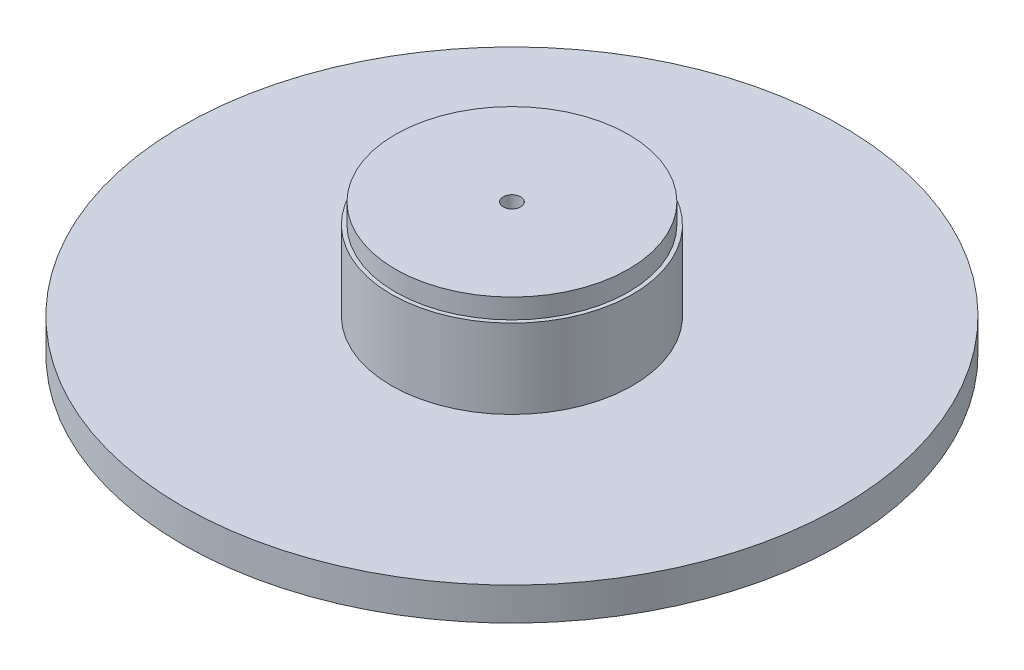
from build123d import *

# Parameters (mm, degrees)
SKETCH1_R                                           = 127
SKETCH1_R_2                                         = 46.482
BOSS_EXTRUDE4_DEPTH                                 = 12.7
SKETCH1_6_R                                         = 46.482
SKETCH1_6_R_2                                       = 44.958
BOSS_EXTRUDE5_DEPTH                                 = 43.18
SKETCH1_7_R                                         = 44.958
BOSS_EXTRUDE6_DEPTH                                 = 50.8
CSK_FOR_1_4_FLAT_HEAD_MACHINE_SCREW_100_D           = 6.7564
CSK_FOR_1_4_FLAT_HEAD_MACHINE_SCREW_100_CSINK_D     = 12.8778
CSK_FOR_1_4_FLAT_HEAD_MACHINE_SCREW_100_CSINK_ANGLE = 100


with BuildPart() as part:
    # Sketch1 → Boss-Extrude4 (new body)
    with BuildSketch(Plane(origin=(0, 0, 0), x_dir=(1, 0, 0), z_dir=(0, 1, 0))):
        Circle(SKETCH1_R)
        Circle(SKETCH1_R_2, mode=Mode.SUBTRACT)
    extrude(amount=BOSS_EXTRUDE4_DEPTH)

    # Sketch1<6> → Boss-Extrude5 (add)
    with BuildSketch(Plane(origin=(0, 0, 0), x_dir=(1, 0, 0), z_dir=(0, 1, 0))):
        Circle(SKETCH1_6_R)
        Circle(SKETCH1_6_R_2, mode=Mode.SUBTRACT)
    extrude(amount=BOSS_EXTRUDE5_DEPTH)

    # Sketch1<7> → Boss-Extrude6 (add)
    with BuildSketch(Plane(origin=(0, 0, 0), x_dir=(1, 0, 0), z_dir=(0, 1, 0))):
        Circle(SKETCH1_7_R)
    extrude(amount=BOSS_EXTRUDE6_DEPTH)

    # CSK for 1/4 Flat Head Machine Screw (100)1 (through all)
    with Locations(Plane(origin=(0, 0, 0), x_dir=(-1, 0, 0), z_dir=(0, -1, 0))):
        with Locations((0, 0)):
            CounterSinkHole(CSK_FOR_1_4_FLAT_HEAD_MACHINE_SCREW_100_D / 2, CSK_FOR_1_4_FLAT_HEAD_MACHINE_SCREW_100_CSINK_D / 2, counter_sink_angle=CSK_FOR_1_4_FLAT_HEAD_MACHINE_SCREW_100_CSINK_ANGLE)


solid = part.part
